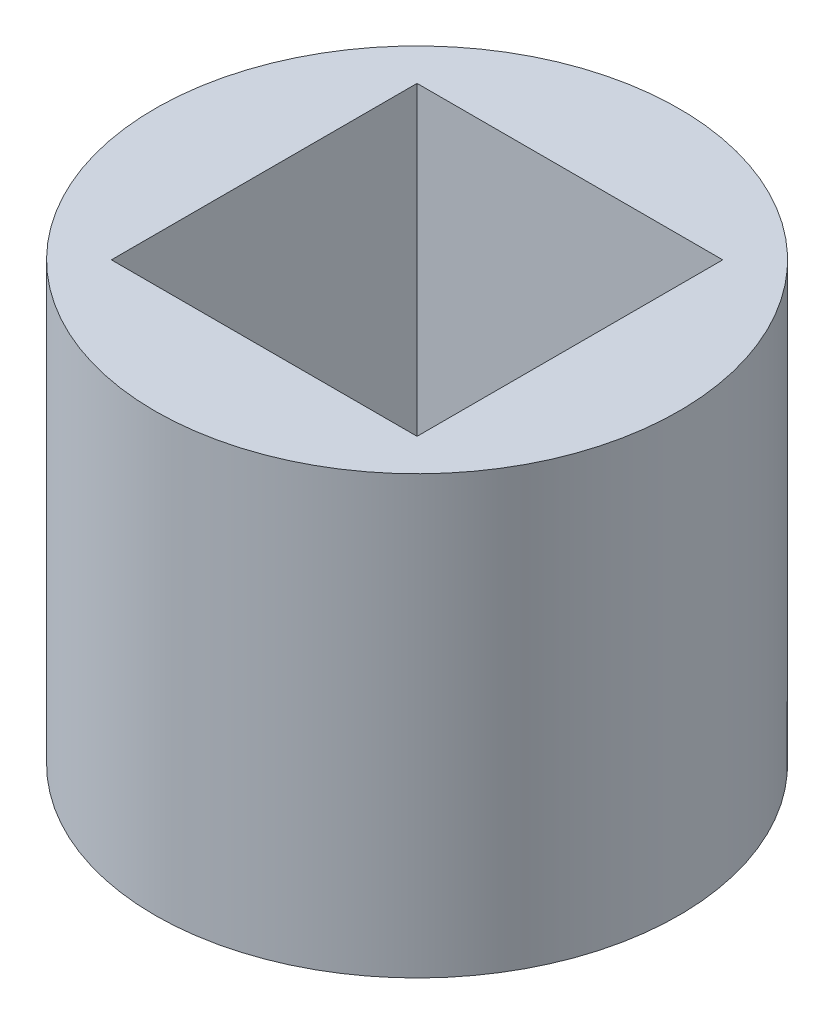
from build123d import *

# Parameters (mm, degrees)
SKETCH1_R           = 7.62
SKETCH1_W           = 8.89
SKETCH1_H           = 8.89
BOSS_EXTRUDE1_DEPTH = 12.7


with BuildPart() as part:
    # Sketch1 → Boss-Extrude1 (new body)
    with BuildSketch(Plane(origin=(0, 0, 0), x_dir=(1, 0, 0), z_dir=(0, 1, 0))):
        with Locations((4.445, 4.445)):
            Circle(SKETCH1_R)
        with Locations((4.445, 4.445)):
            Rectangle(SKETCH1_W, SKETCH1_H, mode=Mode.SUBTRACT)
    extrude(amount=BOSS_EXTRUDE1_DEPTH)


solid = part.part
